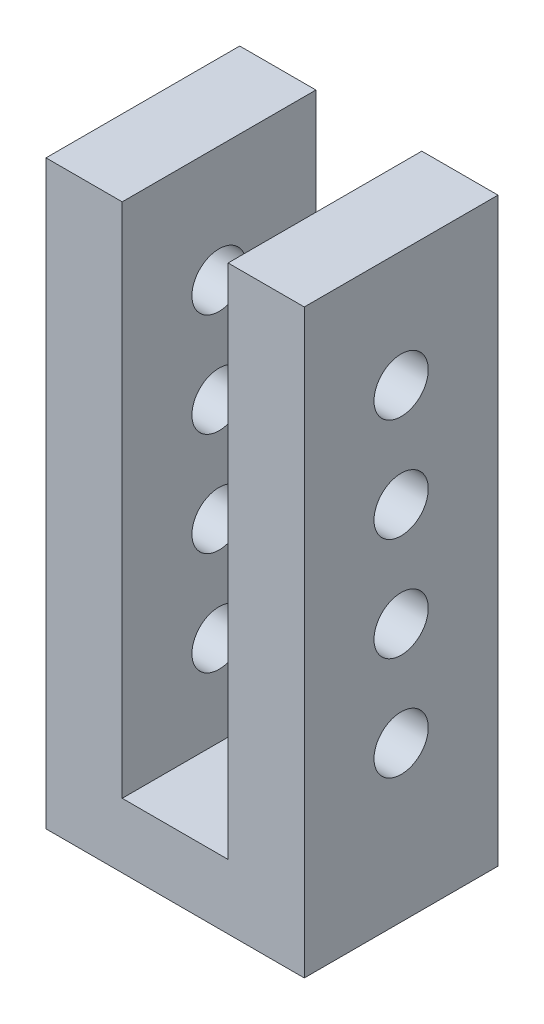
from build123d import *

# Parameters (mm, degrees)
SKETCH_5_W          = 20
SKETCH_5_H          = 15
EXTRUDE_5_DEPTH     = 5
CUT_EXTRUDE_6_REACH = 27.495
SKETCH_6_R          = 2.1
SKETCH_7_W          = 5.9
SKETCH_7_H          = 15
EXTRUDE_7_DEPTH     = 40
SKETCH_8_R          = 2.1
CUT_EXTRUDE_8_DEPTH = 52.478150705


with BuildPart() as part:
    # Эскиз5 → Вытянуть5 (new body)
    with BuildSketch(Plane(origin=(0, 0, 0), x_dir=(1, 0, 0), z_dir=(0, 1, 0))):
        with Locations((10, 7.5)):
            Rectangle(SKETCH_5_W, SKETCH_5_H)
    extrude(amount=EXTRUDE_5_DEPTH)

    # Эскиз6 → Вытянуть6 (cut, up to next)
    with BuildSketch(Plane(origin=(0, 5, 0), x_dir=(1, 0, 0), z_dir=(0, 1, 0)), mode=Mode.PRIVATE) as cut_extrude_6_sk1:
        with Locations((10, 7.5)):
            Circle(SKETCH_6_R)
    cut_extrude_6_tool1 = extrude(cut_extrude_6_sk1.sketch, amount=-CUT_EXTRUDE_6_REACH, mode=Mode.PRIVATE) & part.part
    add(cut_extrude_6_tool1.solids().sort_by_distance((10, 5, -7.5))[0], mode=Mode.SUBTRACT)

    # Эскиз7 → Вытянуть7 (add)
    with BuildSketch(Plane(origin=(0, 5, 0), x_dir=(1, 0, 0), z_dir=(0, 1, 0))):
        with Locations((2.95, 7.5)):
            Rectangle(SKETCH_7_W, SKETCH_7_H)
        with Locations((17.05, 7.5)):
            Rectangle(SKETCH_7_W, SKETCH_7_H)
    extrude(amount=EXTRUDE_7_DEPTH)

    # Эскиз8 → Вытянуть8 (cut, through all)
    with BuildSketch(Plane.ZY):
        with Locations((-7.5, 20)):
            Circle(SKETCH_8_R)
        with Locations((-7.5, 28)):
            Circle(SKETCH_8_R)
        with Locations((-7.5, 12)):
            Circle(SKETCH_8_R)
        with Locations((-7.5, 36)):
            Circle(SKETCH_8_R)
    extrude(amount=-CUT_EXTRUDE_8_DEPTH, mode=Mode.SUBTRACT)


solid = part.part
